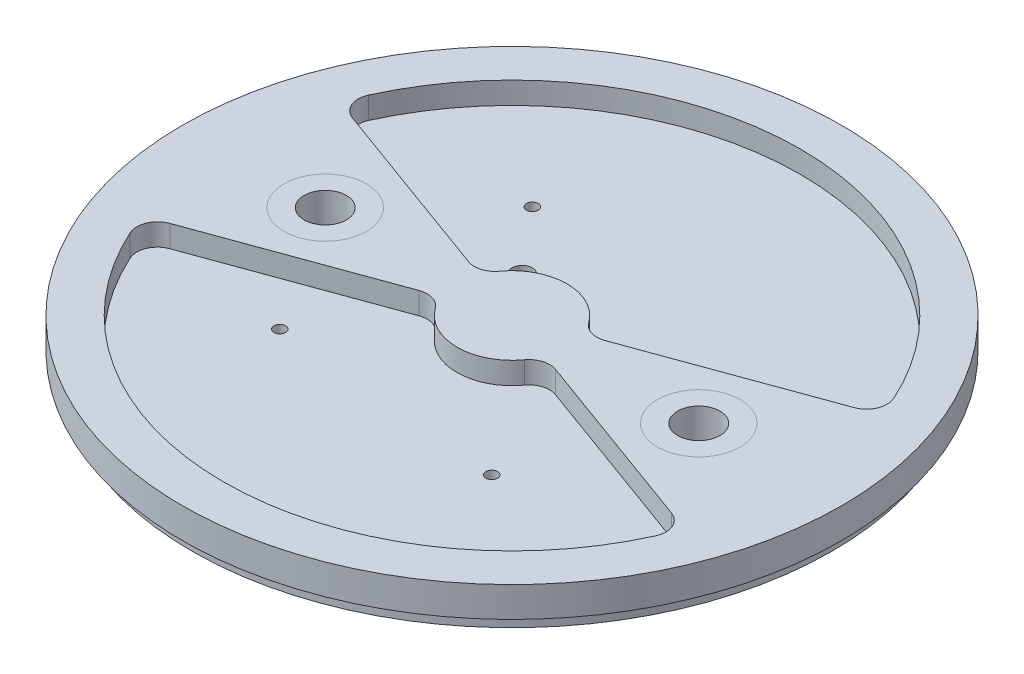
from build123d import *

# Parameters (mm, degrees)
SKETCH1_R                      = 76.2
BOSS_EXTRUDE1_DEPTH            = 10.16
TAP_DRILL_FOR_6_32_TAP1_D      = 2.7051
CIRPATTERN1_COUNT              = 4
W_0_386_DIAMETER_HOLE1_D       = 9.8044
F_3_16_0_1875_DIAMETER_HOLE1_D = 4.7625
CUT_EXTRUDE4_DEPTH             = 3.175
SKETCH15_R                     = 76.2
SKETCH15_R_2                   = 74.041
CUT_EXTRUDE5_DEPTH             = 3.175
SKETCH20_R                     = 1.35255
SKETCH20_R_2                   = 2.38125
CUT_EXTRUDE7_DEPTH             = 5.08
BODY_MOVE_COPY1_ANGLE          = 40


with BuildPart() as part:
    # Sketch1 → Boss-Extrude1 (new body)
    with BuildSketch(Plane(origin=(0, 0, 0), x_dir=(1, 0, 0), z_dir=(0, 1, 0))):
        Circle(SKETCH1_R)
    extrude(amount=BOSS_EXTRUDE1_DEPTH)

    # Tap Drill for #6-32 Tap1 (through all)
    with Locations(Plane(origin=(0, 0, 0), x_dir=(-1, 0, 0), z_dir=(0, -1, 0))):
        with Locations((37.52117539, 6.615995569)):
            tap_drill_for_6_32_tap1 = Hole(TAP_DRILL_FOR_6_32_TAP1_D / 2)

    # CirPattern1: Tap Drill for #6-32 Tap1 ×4 about axis, 1 skipped
    cirpattern1_axis = Axis((0, 0, 0), (0, 1, 0))
    add([tap_drill_for_6_32_tap1.rotate(cirpattern1_axis, i * 360 / CIRPATTERN1_COUNT) for i in range(1, CIRPATTERN1_COUNT) if i not in (3,)], mode=Mode.SUBTRACT)

    # W (0.386) Diameter Hole1 (through all)
    with Locations(Plane(origin=(0, 0, 0), x_dir=(-1, 0, 0), z_dir=(0, -1, 0))):
        with Locations((-33.077799054, 27.755568986), (33.077799054, -27.755568986)):
            Hole(W_0_386_DIAMETER_HOLE1_D / 2)

    # 3/16 (0.1875) Diameter Hole1 (through all)
    with Locations(Plane(origin=(0, 0, 0), x_dir=(-1, 0, 0), z_dir=(0, -1, 0))):
        with Locations((18.760587695, 3.307997785)):
            Hole(F_3_16_0_1875_DIAMETER_HOLE1_D / 2)

    # Sketch12 → Cut-Extrude4 (cut)
    with BuildSketch(Plane.XZ):
        with BuildLine():
            Line((19.886888313, 28.738482206), (6.498907978, 12.783308544))
            ThreePointArc((6.498907978, 12.783308544), (6.898075233, 8.220805941), (11.460577836, 8.619973196))
            Line((11.460577836, 8.619973196), (24.848558171, 24.575146858))
            ThreePointArc((24.848558171, 24.575146858), (24.449390916, 29.137649461), (19.886888313, 28.738482206))
        make_face()
    cut_extrude4 = extrude(amount=-CUT_EXTRUDE4_DEPTH, mode=Mode.SUBTRACT)

    # Mirror1: Cut-Extrude4 across plane
    add(cut_extrude4.mirror(Plane(origin=(0, 0, 0), x_dir=(-0.7660444431189792, 0, 0.6427876096865378), z_dir=(0.6427876096865379, 0, 0.7660444431189792))), mode=Mode.SUBTRACT)

    # Sketch15 → Cut-Extrude5 (cut)
    with BuildSketch(Plane.XZ):
        Circle(SKETCH15_R)
        Circle(SKETCH15_R_2, mode=Mode.SUBTRACT)
    extrude(amount=-CUT_EXTRUDE5_DEPTH, mode=Mode.SUBTRACT)

    # Sketch20 → Cut-Extrude7 (cut)
    # profile 1 of 2: a face of its own
    with BuildSketch(Plane(origin=(0, 10.16, 0), x_dir=(1, 0, 0), z_dir=(0, 1, 0))):
        with BuildLine():
            Line((58.006337644, 21.112580301), (15.787325383, 5.746116518))
            ThreePointArc((15.787325383, 5.746116518), (13.41810781, 3.858627578), (12.666324636, 0.92424034))
            ThreePointArc((12.666324636, 0.92424034), (8.163402625, -9.728764443), (-3.109683289, -12.313402042))
            ThreePointArc((-3.109683289, -12.313402042), (-6.130036388, -12.544212982), (-8.400260426, -14.549677855))
            Line((-8.400260426, -14.549677855), (-30.864527746, -53.458930208))
            ThreePointArc((-30.864527746, -53.458930208), (-31.28945063, -57.248955123), (-28.797011077, -60.135578304))
            ThreePointArc((-28.797011077, -60.135578304), (42.857863777, -51.076013328), (64.222532311, 17.917085938))
            ThreePointArc((64.222532311, 17.917085938), (61.812570917, 20.872916849), (58.006337644, 21.112580301))
        make_face()
        with Locations((-6.615995569, -37.52117539)):
            Circle(SKETCH20_R, mode=Mode.SUBTRACT)
        with Locations((37.52117539, -6.615995569)):
            Circle(SKETCH20_R, mode=Mode.SUBTRACT)
    # profile 2 of 2: a face of its own
    with BuildSketch(Plane(origin=(0, 10.16, 0), x_dir=(1, 0, 0), z_dir=(0, 1, 0))):
        with BuildLine():
            ThreePointArc((-12.666324642, -0.924240256), (-8.16340261, 9.728764456), (3.109683246, 12.313402053))
            ThreePointArc((3.109683246, 12.313402053), (6.130036351, 12.544212967), (8.400260408, 14.549677823))
            Line((8.400260408, 14.549677823), (30.864527463, 53.458929718))
            ThreePointArc((30.864527463, 53.458929718), (31.289450636, 57.248955104), (28.797010604, 60.135578531))
            ThreePointArc((28.797010604, 60.135578531), (-42.857863971, 51.076013165), (-64.222532316, -17.91708592))
            ThreePointArc((-64.222532316, -17.91708592), (-61.812570882, -20.872916867), (-58.006337553, -21.112580268))
            Line((-58.006337553, -21.112580268), (-15.787325417, -5.746116531))
            ThreePointArc((-15.787325417, -5.746116531), (-13.418107797, -3.858627558), (-12.666324642, -0.924240256))
        make_face()
        with Locations((-18.760587695, 3.307997785)):
            Circle(SKETCH20_R_2, mode=Mode.SUBTRACT)
        with Locations((-37.52117539, 6.615995569)):
            Circle(SKETCH20_R, mode=Mode.SUBTRACT)
    extrude(amount=-CUT_EXTRUDE7_DEPTH, mode=Mode.SUBTRACT)


with BuildPart() as part_1:
    # Body-Move/Copy1: moved
    add(part.part.rotate(Axis((0, 0, 0), (0, -1, 0)), BODY_MOVE_COPY1_ANGLE))


solid = part_1.part
